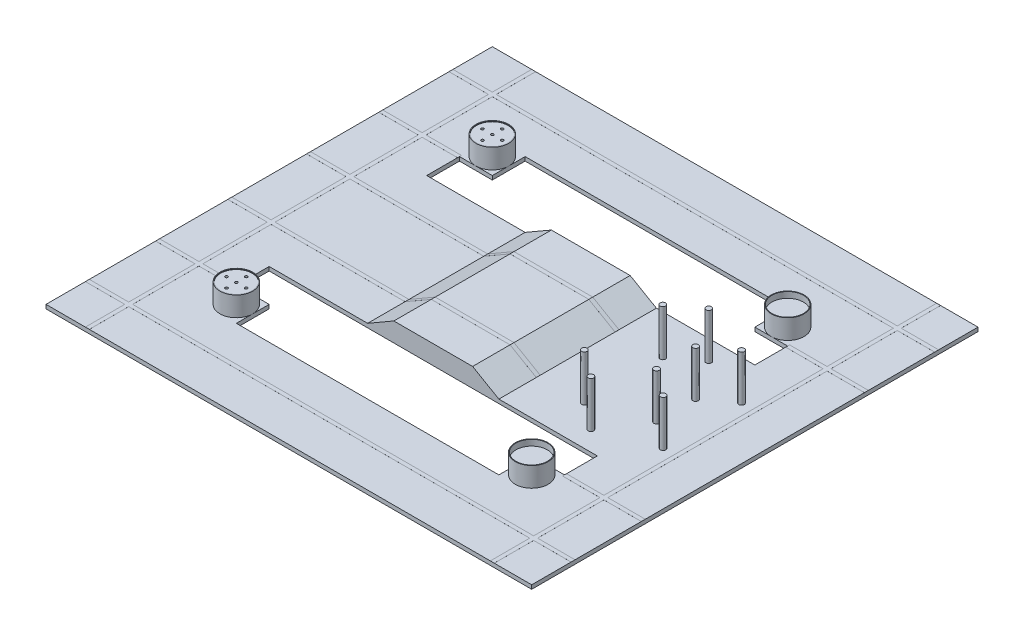
from build123d import *

# Parameters (mm, degrees)
SKETCH1_W               = 3700
SKETCH1_H               = 3400
BOSS_EXTRUDE1_DEPTH     = 30
BOSS_EXTRUDE2_DEPTH     = 600
SKETCH3_R               = 125
BOSS_EXTRUDE3_DEPTH     = 150
SKETCH4_R               = 120
CUT_EXTRUDE1_DEPTH      = 5
SKETCH5_R               = 10
CUT_EXTRUDE2_DEPTH      = 20
MIRROR3_COPY_1_SKETCH_R = 125
MIRROR3_COPY_1_DEPTH    = 150
MIRROR3_COPY_2_SKETCH_R = 120
MIRROR3_COPY_2_DEPTH    = 5
MIRROR3_COPY_3_SKETCH_R = 10
MIRROR3_COPY_3_DEPTH    = 20
MIRROR3_COPY_4_SKETCH_R = 125
MIRROR3_COPY_4_DEPTH    = 150
MIRROR3_COPY_5_SKETCH_R = 120
MIRROR3_COPY_5_DEPTH    = 5
MIRROR3_COPY_6_SKETCH_R = 10
MIRROR3_COPY_6_DEPTH    = 20
SKETCH6_R               = 120
CUT_EXTRUDE3_DEPTH      = 40
SKETCH7_W               = 300
SKETCH7_H               = 300
BOSS_EXTRUDE4_DEPTH     = 0.1
SKETCH8_W               = 3700
SKETCH8_H               = 30
SKETCH8_W_2             = 30
SKETCH8_H_2             = 3400
SKETCH8_W_3             = 600
SKETCH8_W_4             = 2350
EXTRUDE_THIN1_DEPTH     = 0.2
SKETCH9_W               = 230.740107676
SKETCH9_H               = 30
EXTRUDE_THIN2_DEPTH     = 0.1
SKETCH10_W              = 600
SKETCH10_H              = 30
EXTRUDE_THIN3_DEPTH     = 0.1
SKETCH11_R              = 21
BOSS_EXTRUDE5_DEPTH     = 350


with BuildPart() as part:
    # Sketch1 → Boss-Extrude1 (new body)
    with BuildSketch(Plane(origin=(0, 0, 0), x_dir=(1, 0, 0), z_dir=(0, 1, 0))):
        Rectangle(SKETCH1_W, SKETCH1_H)
        Polygon((-1250, -850), (-1250, -600), (1250, -600), (1250, -850), (1000, -850), (1000, -1100), (-1000, -1100), (-1000, -850), align=None, mode=Mode.SUBTRACT)
        Polygon((-1250, 600), (-1250, 850), (-1000, 850), (-1000, 1100), (1000, 1100), (1000, 850), (1250, 850), (1250, 600), align=None, mode=Mode.SUBTRACT)
    extrude(amount=BOSS_EXTRUDE1_DEPTH)

    # Sketch2 → Boss-Extrude2 (add, symmetric)
    with BuildSketch(Plane.XY):
        Polygon((-500, 30), (-300, 145.470053838), (300, 145.470053838), (500, 30), align=None)
    extrude(amount=BOSS_EXTRUDE2_DEPTH, both=True)

    # Sketch3 → Boss-Extrude3 (add)
    with BuildSketch(Plane(origin=(0, 30, 0), x_dir=(1, 0, 0), z_dir=(0, 1, 0))):
        with Locations((-1125, 975)):
            Circle(SKETCH3_R)
    boss_extrude3 = extrude(amount=BOSS_EXTRUDE3_DEPTH)

    # Sketch4 → Cut-Extrude1 (cut)
    with BuildSketch(Plane(origin=(0, 180, 0), x_dir=(1, 0, 0), z_dir=(0, 1, 0))):
        with Locations((-1125, 975)):
            Circle(SKETCH4_R)
    cut_extrude1 = extrude(amount=-CUT_EXTRUDE1_DEPTH, mode=Mode.SUBTRACT)

    # Sketch5 → Cut-Extrude2 (cut)
    with BuildSketch(Plane(origin=(0, 175, 0), x_dir=(1, 0, 0), z_dir=(0, 1, 0))):
        with Locations((-1125, 975)):
            Circle(SKETCH5_R)
        with Locations((-1050, 975)):
            Circle(SKETCH5_R)
        with Locations((-1125, 900)):
            Circle(SKETCH5_R)
        with Locations((-1200, 975)):
            Circle(SKETCH5_R)
        with Locations((-1125, 1050)):
            Circle(SKETCH5_R)
    cut_extrude2 = extrude(amount=-CUT_EXTRUDE2_DEPTH, mode=Mode.SUBTRACT)

    # Mirror2: Boss-Extrude3, Cut-Extrude1, Cut-Extrude2 across plane
    add(boss_extrude3.mirror(Plane.XY))
    add(cut_extrude1.mirror(Plane.XY), mode=Mode.SUBTRACT)
    add(cut_extrude2.mirror(Plane.XY), mode=Mode.SUBTRACT)

    # Mirror3 copy 1 sketch → Mirror3 copy 1 (add)
    with BuildSketch(Plane(origin=(0, 30, 0), x_dir=(-1, 0, 0), z_dir=(0, 1, 0))):
        with Locations((-1125, 975)):
            Circle(MIRROR3_COPY_1_SKETCH_R)
    extrude(amount=MIRROR3_COPY_1_DEPTH)

    # Mirror3 copy 2 sketch → Mirror3 copy 2 (cut)
    with BuildSketch(Plane(origin=(0, 180, 0), x_dir=(-1, 0, 0), z_dir=(0, 1, 0))):
        with Locations((-1125, 975)):
            Circle(MIRROR3_COPY_2_SKETCH_R)
    extrude(amount=-MIRROR3_COPY_2_DEPTH, mode=Mode.SUBTRACT)

    # Mirror3 copy 3 sketch → Mirror3 copy 3 (cut)
    with BuildSketch(Plane(origin=(0, 175, 0), x_dir=(-1, 0, 0), z_dir=(0, 1, 0))):
        with Locations((-1125, 975)):
            Circle(MIRROR3_COPY_3_SKETCH_R)
        with Locations((-1050, 975)):
            Circle(MIRROR3_COPY_3_SKETCH_R)
        with Locations((-1125, 900)):
            Circle(MIRROR3_COPY_3_SKETCH_R)
        with Locations((-1200, 975)):
            Circle(MIRROR3_COPY_3_SKETCH_R)
        with Locations((-1125, 1050)):
            Circle(MIRROR3_COPY_3_SKETCH_R)
    extrude(amount=-MIRROR3_COPY_3_DEPTH, mode=Mode.SUBTRACT)

    # Mirror3 copy 4 sketch → Mirror3 copy 4 (add)
    with BuildSketch(Plane(origin=(0, 30, 0), x_dir=(-1, 0, 0), z_dir=(0, 1, 0))):
        with Locations((-1125, -975)):
            Circle(MIRROR3_COPY_4_SKETCH_R)
    extrude(amount=MIRROR3_COPY_4_DEPTH)

    # Mirror3 copy 5 sketch → Mirror3 copy 5 (cut)
    with BuildSketch(Plane(origin=(0, 180, 0), x_dir=(-1, 0, 0), z_dir=(0, 1, 0))):
        with Locations((-1125, -975)):
            Circle(MIRROR3_COPY_5_SKETCH_R)
    extrude(amount=-MIRROR3_COPY_5_DEPTH, mode=Mode.SUBTRACT)

    # Mirror3 copy 6 sketch → Mirror3 copy 6 (cut)
    with BuildSketch(Plane(origin=(0, 175, 0), x_dir=(-1, 0, 0), z_dir=(0, 1, 0))):
        with Locations((-1125, -975)):
            Circle(MIRROR3_COPY_6_SKETCH_R)
        with Locations((-1050, -975)):
            Circle(MIRROR3_COPY_6_SKETCH_R)
        with Locations((-1125, -900)):
            Circle(MIRROR3_COPY_6_SKETCH_R)
        with Locations((-1200, -975)):
            Circle(MIRROR3_COPY_6_SKETCH_R)
        with Locations((-1125, -1050)):
            Circle(MIRROR3_COPY_6_SKETCH_R)
    extrude(amount=-MIRROR3_COPY_6_DEPTH, mode=Mode.SUBTRACT)

    # Sketch6 → Cut-Extrude3 (cut)
    with BuildSketch(Plane(origin=(0, 175, 0), x_dir=(1, 0, 0), z_dir=(0, 1, 0))):
        with Locations((1125, 975)):
            Circle(SKETCH6_R)
    cut_extrude3 = extrude(amount=-CUT_EXTRUDE3_DEPTH, mode=Mode.SUBTRACT)

    # Mirror4: Cut-Extrude3 across plane
    add(cut_extrude3.mirror(Plane.XY), mode=Mode.SUBTRACT)

    # Sketch7 → Boss-Extrude4 (add)
    with BuildSketch(Plane(origin=(0, 30, 0), x_dir=(1, 0, 0), z_dir=(0, 1, 0))):
        with Locations((-1700, 1550)):
            Rectangle(SKETCH7_W, SKETCH7_H)
        with Locations((-1700, -1550)):
            Rectangle(SKETCH7_W, SKETCH7_H)
    extrude(amount=BOSS_EXTRUDE4_DEPTH)

    # Sketch8 → Extrude-Thin1 (add)
    with BuildSketch(Plane(origin=(0, 30, 0), x_dir=(1, 0, 0), z_dir=(0, 1, 0))):
        with Locations((0, 1385)):
            Rectangle(SKETCH8_W, SKETCH8_H)
        with Locations((-1535, 0)):
            Rectangle(SKETCH8_W_2, SKETCH8_H_2)
        with Locations((1550, 0)):
            Rectangle(SKETCH8_W_2, SKETCH8_H_2)
        with Locations((-1550, 850)):
            Rectangle(SKETCH8_W_3, SKETCH8_H)
        with Locations((-675, 300)):
            Rectangle(SKETCH8_W_4, SKETCH8_H)
        with Locations((-675, -300)):
            Rectangle(SKETCH8_W_4, SKETCH8_H)
        with Locations((0, -1385)):
            Rectangle(SKETCH8_W, SKETCH8_H)
        with Locations((-1550, -850)):
            Rectangle(SKETCH8_W_3, SKETCH8_H)
        with Locations((1550, 850)):
            Rectangle(SKETCH8_W_3, SKETCH8_H)
        with Locations((1550, -850)):
            Rectangle(SKETCH8_W_3, SKETCH8_H)
    extrude(amount=EXTRUDE_THIN1_DEPTH)

    # Sketch9 → Extrude-Thin2 (add)
    with BuildSketch(Plane(origin=(-137.990381057, 239.006350946, 0), x_dir=(0.8660254037844415, 0.4999999999999951, 0), z_dir=(-0.49999999999999517, 0.8660254037844416, 0))):
        with Locations((-302.442648054, 300)):
            Rectangle(SKETCH9_W, SKETCH9_H)
        with Locations((-302.442648054, -300)):
            Rectangle(SKETCH9_W, SKETCH9_H)
    extrude_thin2 = extrude(amount=EXTRUDE_THIN2_DEPTH)

    # Sketch10 → Extrude-Thin3 (add)
    with BuildSketch(Plane(origin=(0, 145.470053838, 0), x_dir=(1, 0, 0), z_dir=(0, 1, 0))):
        with Locations((0, 300)):
            Rectangle(SKETCH10_W, SKETCH10_H)
        with Locations((0, -300)):
            Rectangle(SKETCH10_W, SKETCH10_H)
    extrude(amount=EXTRUDE_THIN3_DEPTH)

    # Mirror5: Extrude-Thin2 across plane
    add(extrude_thin2.mirror(Plane(origin=(0, 0, 0), x_dir=(0, 0, 1), z_dir=(1, 0, 0))))

    # Sketch11 → Boss-Extrude5 (add)
    with BuildSketch(Plane(origin=(0, 30, 0), x_dir=(1, 0, 0), z_dir=(0, 1, 0))):
        with Locations((850, -298.836957303)):
            Circle(SKETCH11_R)
        with Locations((1050, -448.836957303)):
            Circle(SKETCH11_R)
        with Locations((1450, -298.836957303)):
            Circle(SKETCH11_R)
        with Locations((1250, -148.836957303)):
            Circle(SKETCH11_R)
    boss_extrude5 = extrude(amount=BOSS_EXTRUDE5_DEPTH)

    # Mirror6: Boss-Extrude5 across plane
    add(boss_extrude5.mirror(Plane.XY))


solid = part.part
